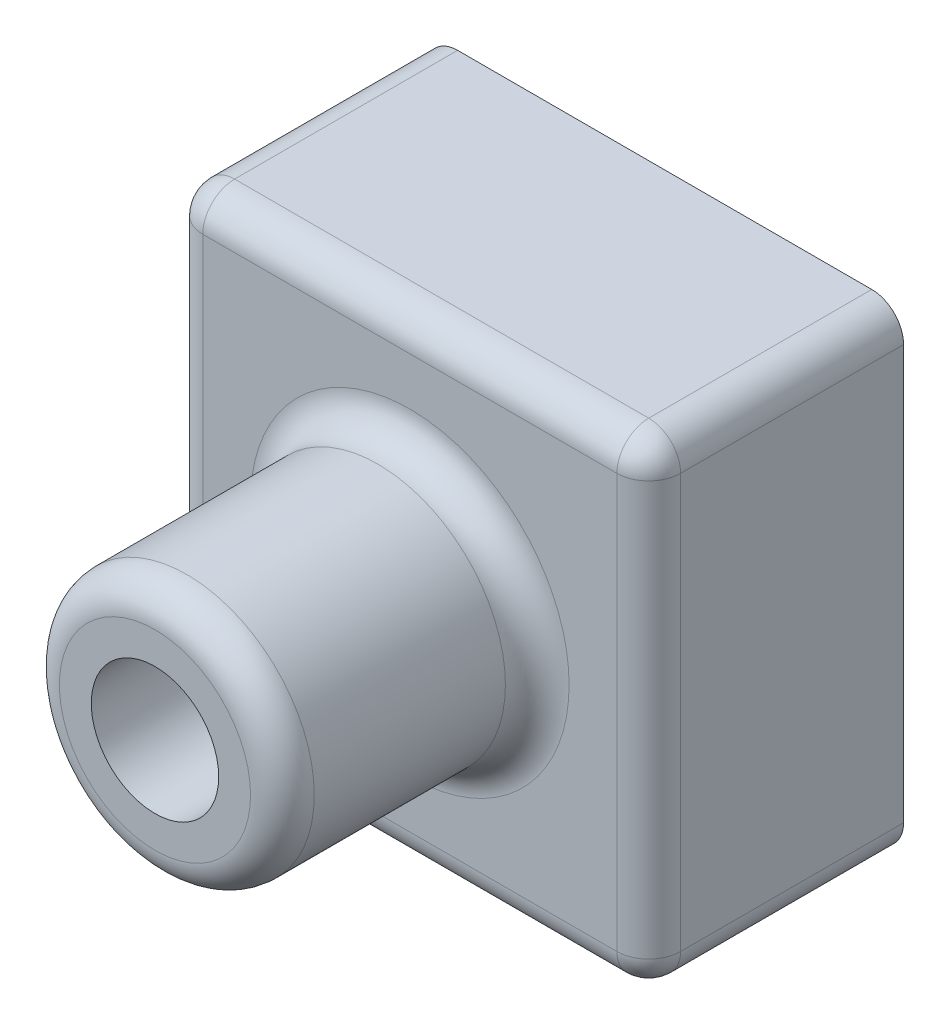
from build123d import *

# Parameters (mm, degrees)
SKETCH1_W           = 75
SKETCH1_H           = 75
BOSS_EXTRUDE1_DEPTH = 40
SKETCH2_R           = 20
BOSS_EXTRUDE2_DEPTH = 40
FILLET1_R           = 5
SKETCH3_R           = 10
CUT_EXTRUDE1_DEPTH  = 96.981769102


with BuildPart() as part:
    # Sketch1 → Boss-Extrude1 (new body)
    with BuildSketch(Plane.XY):
        Rectangle(SKETCH1_W, SKETCH1_H)
    extrude(amount=BOSS_EXTRUDE1_DEPTH)

    # Sketch2 → Boss-Extrude2 (add)
    with BuildSketch(Plane.XY.offset(40)):
        Circle(SKETCH2_R)
    extrude(amount=BOSS_EXTRUDE2_DEPTH)

    # Fillet1
    fillet1_edges = [part.edges().sort_by_distance(p)[0] for p in [
        (-37.5, 37.5, 20),
        (-37.5, -37.5, 20),
        (37.5, 37.5, 20),
        (37.5, -37.5, 20),
        (-37.5, 0, 40),
        (0, 37.5, 40),
        (37.5, 0, 40),
        (0, -37.5, 40),
        (-20, 0, 40),
        (-20, 0, 80),
    ]]
    fillet(fillet1_edges, radius=FILLET1_R)

    # Sketch3 → Cut-Extrude1 (cut, through all)
    with BuildSketch(Plane.XY.offset(80)):
        Circle(SKETCH3_R)
    extrude(amount=-CUT_EXTRUDE1_DEPTH, mode=Mode.SUBTRACT)


solid = part.part
